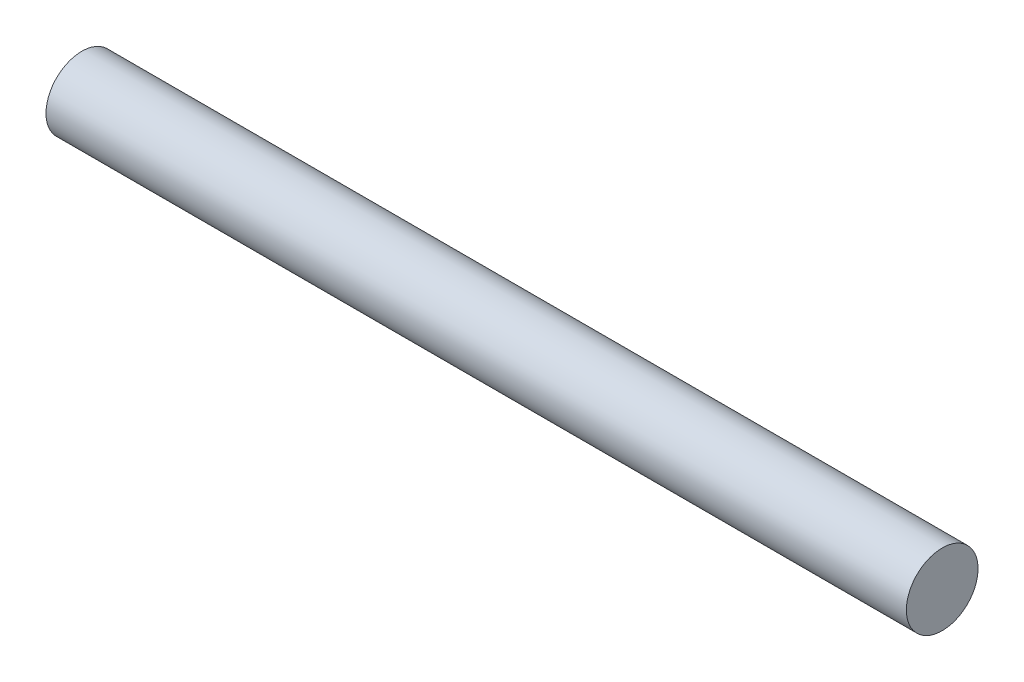
from build123d import *

# Parameters (mm, degrees)
SKETCH1_R           = 3.175
BOSS_EXTRUDE1_DEPTH = 76.2


with BuildPart() as part:
    # Sketch1 → Boss-Extrude1 (new body)
    with BuildSketch(Plane(origin=(0, 0, 0), x_dir=(0, 0, -1), z_dir=(1, 0, 0))):
        Circle(SKETCH1_R)
    extrude(amount=BOSS_EXTRUDE1_DEPTH)


solid = part.part
